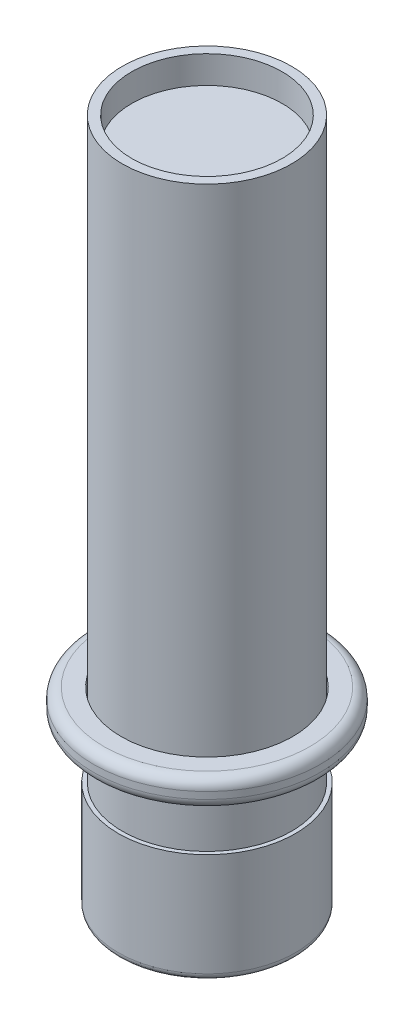
from build123d import *

# Parameters (mm, degrees)
SKETCH1_R                  = 6.15
BOSS_EXTRUDE1_DEPTH        = 38
SKETCH4_R                  = 4.95
CUT_EXTRUDE2_DEPTH         = 35
SKETCH7_R                  = 8.271925693
SKETCH7_R_2                = 6.15
BOSS_EXTRUDE3_DEPTH        = 2.1
FILLET2_R                  = 1
SKETCH8_R                  = 5.466664299
CUT_EXTRUDE3_DEPTH         = 2
BOSS_EXTRUDE4_START        = 4
SKETCH9_R                  = 6.15
SKETCH9_R_2                = 4.95
BOSS_EXTRUDE4_DEPTH        = 4
SKETCH10_R                 = 4.95
BOSS_EXTRUDE5_DEPTH        = 18
SKETCH12_R                 = 3.675171346
BOSS_EXTRUDE6_DEPTH        = 2
SKETCH11_R                 = 4.812300359
CUT_EXTRUDE5_DEPTH         = 2
SKETCH13_R                 = 3.63
BOSS_EXTRUDE7_DEPTH        = 2
SKETCH15_W                 = 6.7
SKETCH15_H                 = 6.7
BOSS_EXTRUDE8_DEPTH        = 10
FILLET3_R                  = 2
SKETCH16_R                 = 6.437602848
BOSS_EXTRUDE9_DEPTH        = 8
FILLET4_R                  = 2
CUT_EXTRUDE6_START         = -2.2
SKETCH20_R                 = 8.783510696
SKETCH20_R_2               = 6.15
CUT_EXTRUDE6_DEPTH         = 2.2
BOSS_EXTRUDE12_OUTLINE_R   = 8.238368975
BOSS_EXTRUDE12_OUTLINE_R_2 = 6.235668254
BOSS_EXTRUDE12_DEPTH       = 2
FILLET5_R                  = 0.75
SKETCH21_R                 = 4.693813241
CUT_EXTRUDE7_DEPTH         = 5
SKETCH24_R                 = 4.882922789
BOSS_EXTRUDE13_DEPTH       = 2
FILLET6_R                  = 0.5


# Read off the part's stored shape, not the designer's step: Boss-Extrude12
with BuildPart() as part:
    # Sketch1 → Boss-Extrude1 (new body)
    with BuildSketch(Plane(origin=(0, 0, 0), x_dir=(1, 0, 0), z_dir=(0, 1, 0))):
        with Locations(Location((0, 0, 0), (0, 0, 270))):
            Circle(SKETCH1_R)
    extrude(amount=BOSS_EXTRUDE1_DEPTH)

    # Sketch4 → Cut-Extrude2 (cut)
    with BuildSketch(Plane(origin=(0, 0, 0), x_dir=(1, 0, 0), z_dir=(0, 1, 0))):
        with Locations(Location((0, 0, 0), (0, 0, 270))):
            Circle(SKETCH4_R)
    extrude(amount=CUT_EXTRUDE2_DEPTH, mode=Mode.SUBTRACT)

    # Sketch7 → Boss-Extrude3 (add)
    with BuildSketch(Plane(origin=(0, 0, 0), x_dir=(1, 0, 0), z_dir=(0, 1, 0))):
        with Locations(Location((0, 0, 0), (0, 0, 270))):
            Circle(SKETCH7_R)
        with Locations(Location((0, 0, 0), (0, 0, 270))):
            Circle(SKETCH7_R_2, mode=Mode.SUBTRACT)
    extrude(amount=BOSS_EXTRUDE3_DEPTH)

    # Fillet2
    fillet2_edges = [part.edges().sort_by_distance(p)[0] for p in [
        (0, 2.1, -8.271925693),
        (0, 0, -8.271925693),
    ]]
    fillet(fillet2_edges, radius=FILLET2_R)

    # Sketch8 → Cut-Extrude3 (cut)
    with BuildSketch(Plane(origin=(0, 38, 0), x_dir=(1, 0, 0), z_dir=(0, 1, 0))):
        with Locations(Location((0, 0, 0), (0, 0, 270))):
            Circle(SKETCH8_R)
    extrude(amount=-CUT_EXTRUDE3_DEPTH, mode=Mode.SUBTRACT)

    # Sketch9 → Boss-Extrude4 (add)
    with BuildSketch(Plane.XZ.offset(BOSS_EXTRUDE4_START)):
        with Locations(Location((0, 0, 0), (0, 0, 90))):
            Circle(SKETCH9_R)
        with Locations(Location((0, 0, 0), (0, 0, 270))):
            Circle(SKETCH9_R_2, mode=Mode.SUBTRACT)
    extrude(amount=-BOSS_EXTRUDE4_DEPTH)

    # Sketch20 → Cut-Extrude6 (cut)
    with BuildSketch(Plane(origin=(0, 2.1, 0), x_dir=(1, 0, 0), z_dir=(0, 1, 0)).offset(CUT_EXTRUDE6_START)):
        Circle(SKETCH20_R)
        with Locations(Location((0, 0, 0), (0, 0, 90))):
            Circle(SKETCH20_R_2, mode=Mode.SUBTRACT)
    extrude(amount=CUT_EXTRUDE6_DEPTH, mode=Mode.SUBTRACT)


with BuildPart() as body_2:
    # Sketch10 → Boss-Extrude5 (new body)
    with BuildSketch(Plane.XZ.offset(-35)):
        with Locations(Location((0, 0, 0), (0, 0, 270))):
            Circle(SKETCH10_R)
    extrude(amount=BOSS_EXTRUDE5_DEPTH)

    # Sketch11 → Cut-Extrude5 (cut)
    with BuildSketch(Plane.XZ.offset(-17)):
        with Locations(Location((0, 0, 0), (0, 0, 270))):
            Circle(SKETCH11_R)
    extrude(amount=-CUT_EXTRUDE5_DEPTH, mode=Mode.SUBTRACT)

    # Fillet4
    fillet4_edges = [body_2.edges().sort_by_distance(p)[0] for p in [
        (0, 19, 4.812300359),
    ]]
    fillet(fillet4_edges, radius=FILLET4_R - 0.0001)  # a hair under: the kernel refuses the full size


with BuildPart() as body_3:
    # Sketch12 → Boss-Extrude6 (new body)
    with BuildSketch(Plane.XZ.offset(-35)):
        with Locations(Location((0, 0, 0), (0, 0, 270))):
            Circle(SKETCH12_R)
    extrude(amount=BOSS_EXTRUDE6_DEPTH)


with BuildPart() as body_4:
    # Sketch13 → Boss-Extrude7 (new body)
    with BuildSketch(Plane.XZ.offset(-19)):
        with Locations(Location((0, 0, 0), (0, 0, 270))):
            Circle(SKETCH13_R)
    extrude(amount=-BOSS_EXTRUDE7_DEPTH)


with BuildPart() as body_5:
    # Sketch15 → Boss-Extrude8 (new body)
    with BuildSketch(Plane.XZ.offset(-33)):
        Rectangle(SKETCH15_W, SKETCH15_H)
    extrude(amount=BOSS_EXTRUDE8_DEPTH)

    # Fillet3
    fillet3_edges = [body_5.edges().sort_by_distance(p)[0] for p in [
        (-3.35, 23, 0),
        (0, 23, -3.35),
        (3.35, 23, 0),
        (0, 33, -3.35),
        (-3.35, 33, 0),
        (0, 33, 3.35),
        (3.35, 33, 0),
        (3.35, 28, -3.35),
        (-3.35, 28, -3.35),
        (-3.35, 28, 3.35),
        (3.35, 28, 3.35),
        (0, 23, 3.35),
    ]]
    fillet(fillet3_edges, radius=FILLET3_R)


with BuildPart() as body_6:
    # Sketch16 → Boss-Extrude9 (new body)
    with BuildSketch(Plane.XZ.offset(4)):
        with Locations(Location((0, 0, 0), (0, 0, 270))):
            Circle(SKETCH16_R)
    extrude(amount=BOSS_EXTRUDE9_DEPTH)

    # Sketch21 → Cut-Extrude7 (cut)
    with BuildSketch(Plane.XZ.offset(12)):
        with Locations(Location((0, 0, 0), (0, 0, 270))):
            Circle(SKETCH21_R)
    extrude(amount=-CUT_EXTRUDE7_DEPTH, mode=Mode.SUBTRACT)

    # Sketch24 → Boss-Extrude13 (add)
    with BuildSketch(Plane(origin=(0, -4, 0), x_dir=(1, 0, 0), z_dir=(0, 1, 0))):
        with Locations(Location((0, 0, 0), (0, 0, 270))):
            Circle(SKETCH24_R)
    extrude(amount=BOSS_EXTRUDE13_DEPTH)

    # Fillet6
    fillet6_edges = [body_6.edges().sort_by_distance(p)[0] for p in [
        (0, -12, 6.437602848),
    ]]
    fillet(fillet6_edges, radius=FILLET6_R)


with BuildPart() as body_7:
    # Boss-Extrude12 outline → Boss-Extrude12 (new body)
    with BuildSketch(Plane(origin=(0, 0, 0), x_dir=(1, 0, 0), z_dir=(0, 1, 0))):
        Circle(BOSS_EXTRUDE12_OUTLINE_R)
        Circle(BOSS_EXTRUDE12_OUTLINE_R_2, mode=Mode.SUBTRACT)
    extrude(amount=BOSS_EXTRUDE12_DEPTH)

    # Fillet5
    fillet5_edges = [body_7.edges().sort_by_distance(p)[0] for p in [
        (-8.238368975, 2, 0),
        (-8.238368975, 0, 0),
    ]]
    fillet(fillet5_edges, radius=FILLET5_R)


solid = Compound([part.part, body_2.part, body_3.part, body_4.part, body_5.part, body_6.part, body_7.part])
